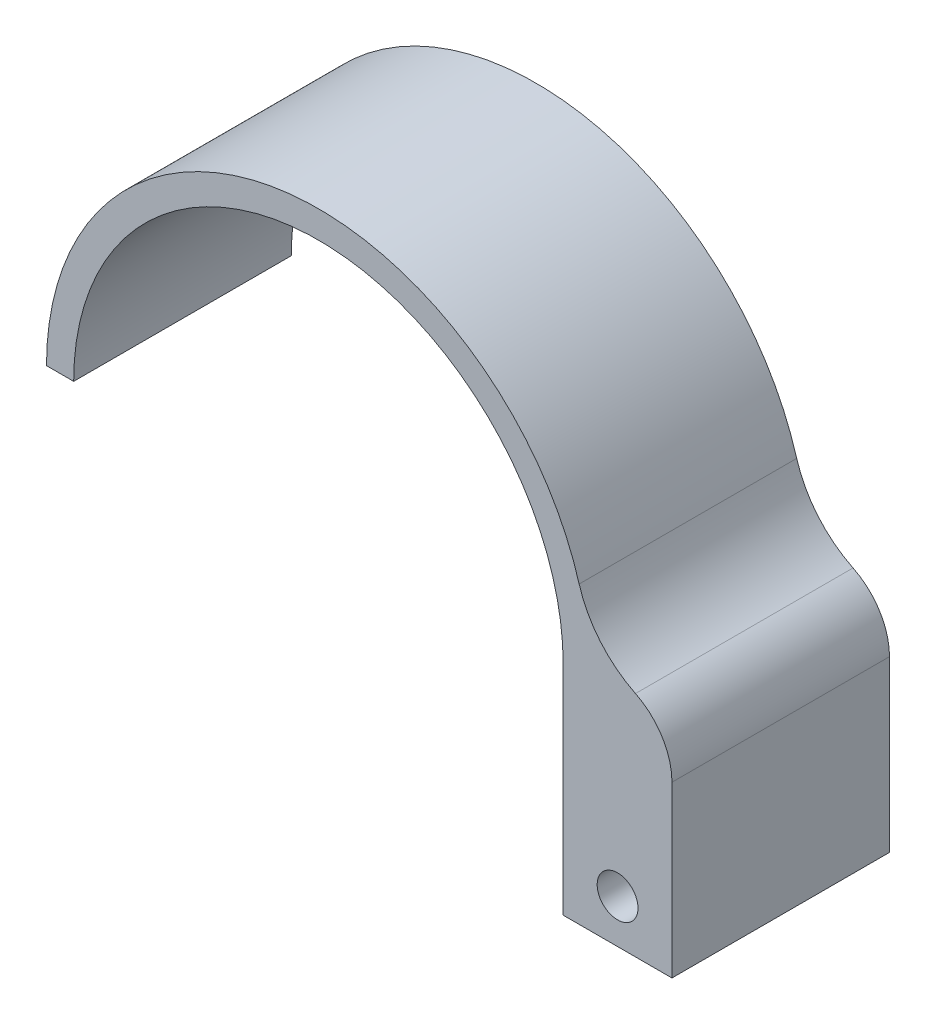
from build123d import *

# Parameters (mm, degrees)
BOSS_EXTRUDE1_DEPTH = 25.4
FILLET1_R           = 12.7
FILLET2_R           = 7.62
CUT_EXTRUDE1_DEPTH  = 21.59
SKETCH3_R           = 4.7625
CUT_EXTRUDE2_DEPTH  = 2.54
SKETCH4_R           = 2.38125
CUT_EXTRUDE3_DEPTH  = 58.938313101


with BuildPart() as part:
    # Sketch1 → Boss-Extrude1 (new body)
    with BuildSketch(Plane.XY):
        with BuildLine():
            ThreePointArc((-28.575, 0), (0, 28.575), (28.575, 0))
            Line((28.575, 0), (28.575, -25.4))
            Line((28.575, -25.4), (41.275, -25.4))
            Line((41.275, -25.4), (41.275, 0))
            Line((41.275, 0), (31.75, 0))
            ThreePointArc((31.75, 0), (0, 31.75), (-31.75, 0))
            Line((-31.75, 0), (-28.575, 0))
        make_face()
    extrude(amount=BOSS_EXTRUDE1_DEPTH)

    # Fillet1
    # the kernel refuses this fillet: 12.7 mm, written as the material it adds along each edge
    with BuildSketch(Plane(origin=(31.75, 0, 0), x_dir=(1, 0, 0), z_dir=(0, 0, 1))) as fillet1_piece_1:
        with BuildLine():
            CenterArc((10.868269231, 12.628761926), FILLET1_R, 196.505753727, 67.422759238)
            Line((-1.308379121, 9.020544233), (-1.551912088, 8.948379879))
            ThreePointArc((-1.551912088, 8.948379879), (-0.580166885, 4.521008688), (-0.254, 0))
            Line((-0.254, 0), (0, -0.254))
            ThreePointArc((0, -0.254), (4.7625, -0.254), (9.498134615, -0.252575239))
            Line((9.498134615, -0.252575239), (9.525, 0))
        make_face()
    extrude(amount=25.4)

    # Fillet2
    fillet2_edges = [part.edges().sort_by_distance(p)[0] for p in [
        (41.275, 0, 12.7),
    ]]
    fillet(fillet2_edges, radius=FILLET2_R)

    # Sketch2 → Cut-Extrude1 (cut)
    with BuildSketch(Plane(origin=(0, -25.4, 0), x_dir=(-1, 0, 0), z_dir=(0, -1, 0))):
        with BuildLine():
            ThreePointArc((-38.474757914, -9.525), (-39.6875, -12.7), (-38.474757914, -15.875))
            Line((-38.474757914, -15.875), (-31.375242086, -15.875))
            ThreePointArc((-31.375242086, -15.875), (-30.47600414, -14.399365203), (-30.1625, -12.7))
            ThreePointArc((-30.1625, -12.7), (-30.47600414, -11.000634797), (-31.375242086, -9.525))
            Line((-31.375242086, -9.525), (-38.474757914, -9.525))
        make_face()
    extrude(amount=-CUT_EXTRUDE1_DEPTH, mode=Mode.SUBTRACT)

    # Sketch3 → Cut-Extrude2 (cut)
    with BuildSketch(Plane.XZ.offset(25.4)):
        with Locations(Location((34.925, 12.7, 0), (0, 0, 270))):
            Circle(SKETCH3_R)
    extrude(amount=-CUT_EXTRUDE2_DEPTH, mode=Mode.SUBTRACT)

    # Sketch4 → Cut-Extrude3 (cut, through all)
    with BuildSketch(Plane.XY.offset(25.4)):
        with Locations((34.925, -20.32)):
            Circle(SKETCH4_R)
    extrude(amount=-CUT_EXTRUDE3_DEPTH, mode=Mode.SUBTRACT)


solid = part.part
